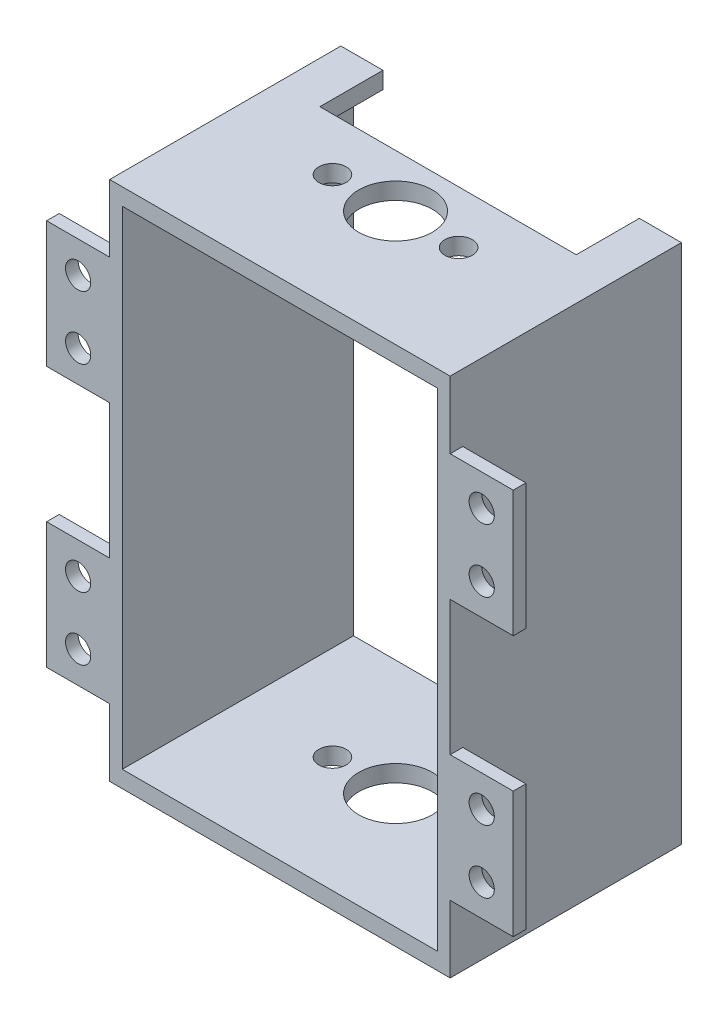
from build123d import *

# Parameters (mm, degrees)
SKETCH1_W           = 75
SKETCH1_H           = 55
SKETCH1_R           = 8.75
SKETCH1_R_2         = 3.25
BOSS_EXTRUDE1_DEPTH = 4
SKETCH2_W           = 55
SKETCH2_H           = 120
BOSS_EXTRUDE2_DEPTH = 3
SKETCH3_W           = 81
SKETCH3_H           = 55
SKETCH3_R           = 8.75
SKETCH3_R_2         = 3.25
BOSS_EXTRUDE3_DEPTH = 4
SKETCH5_W           = 15
SKETCH5_H           = 30
SKETCH5_R           = 3
BOSS_EXTRUDE5_DEPTH = 3
CUT_EXTRUDE1_REACH  = 166.469
SKETCH6_W           = 61
SKETCH6_H           = 15


with BuildPart() as part:
    # Sketch1 → Boss-Extrude1 (new body)
    with BuildSketch(Plane(origin=(0, 0, 0), x_dir=(1, 0, 0), z_dir=(0, 1, 0))):
        with Locations((37.5, 27.5)):
            Rectangle(SKETCH1_W, SKETCH1_H)
        with Locations((37.5, 27.5)):
            Circle(SKETCH1_R, mode=Mode.SUBTRACT)
        with Locations((22.5, 27.5)):
            Circle(SKETCH1_R_2, mode=Mode.SUBTRACT)
        with Locations((52.5, 27.5)):
            Circle(SKETCH1_R_2, mode=Mode.SUBTRACT)
    extrude(amount=BOSS_EXTRUDE1_DEPTH)

    # Sketch2 → Boss-Extrude2 (add)
    with BuildSketch(Plane.ZY):
        with Locations((-27.5, 60)):
            Rectangle(SKETCH2_W, SKETCH2_H)
    boss_extrude2 = extrude(amount=BOSS_EXTRUDE2_DEPTH)

    # Mirror1: Boss-Extrude2 across plane
    add(boss_extrude2.mirror(Plane(origin=(37.5, 0, 0), x_dir=(0, 0, 1), z_dir=(1, 0, 0))))

    # Sketch3 → Boss-Extrude3 (add)
    with BuildSketch(Plane(origin=(0, 120, 0), x_dir=(1, 0, 0), z_dir=(0, 1, 0))):
        with Locations((37.5, 27.5)):
            Rectangle(SKETCH3_W, SKETCH3_H)
        with Locations((37.5, 27.5)):
            Circle(SKETCH3_R, mode=Mode.SUBTRACT)
        with Locations((22.5, 27.5)):
            Circle(SKETCH3_R_2, mode=Mode.SUBTRACT)
        with Locations((52.5, 27.5)):
            Circle(SKETCH3_R_2, mode=Mode.SUBTRACT)
    extrude(amount=BOSS_EXTRUDE3_DEPTH)

    # Sketch5 → Boss-Extrude5 (add)
    # profile 1 of 2: a face of its own
    with BuildSketch(Plane.XY):
        with Locations((-10.5, 93)):
            Rectangle(SKETCH5_W, SKETCH5_H)
        with Locations((-10.5, 100.5)):
            Circle(SKETCH5_R, mode=Mode.SUBTRACT)
        with Locations((-10.5, 85.5)):
            Circle(SKETCH5_R, mode=Mode.SUBTRACT)
    # profile 2 of 2: a face of its own
    with BuildSketch(Plane.XY):
        with Locations((-10.5, 31)):
            Rectangle(SKETCH5_W, SKETCH5_H)
        with Locations((-10.5, 38.5)):
            Circle(SKETCH5_R, mode=Mode.SUBTRACT)
        with Locations((-10.5, 23.5)):
            Circle(SKETCH5_R, mode=Mode.SUBTRACT)
    boss_extrude5 = extrude(amount=-BOSS_EXTRUDE5_DEPTH)

    # Mirror2: Boss-Extrude5 across plane
    add(boss_extrude5.mirror(Plane(origin=(37.5, 0, 0), x_dir=(0, 0, 1), z_dir=(1, 0, 0))))

    # Sketch6 → Cut-Extrude1 (cut, up to next)
    with BuildSketch(Plane(origin=(0, 124, 0), x_dir=(1, 0, 0), z_dir=(0, 1, 0)), mode=Mode.PRIVATE) as cut_extrude1_sk1:
        with Locations((37.5, 47.5)):
            Rectangle(SKETCH6_W, SKETCH6_H)
    cut_extrude1_tool1 = extrude(cut_extrude1_sk1.sketch, amount=-CUT_EXTRUDE1_REACH, mode=Mode.PRIVATE) & part.part
    add(cut_extrude1_tool1.solids().sort_by_distance((37.5, 124, -47.5))[0], mode=Mode.SUBTRACT)


solid = part.part
